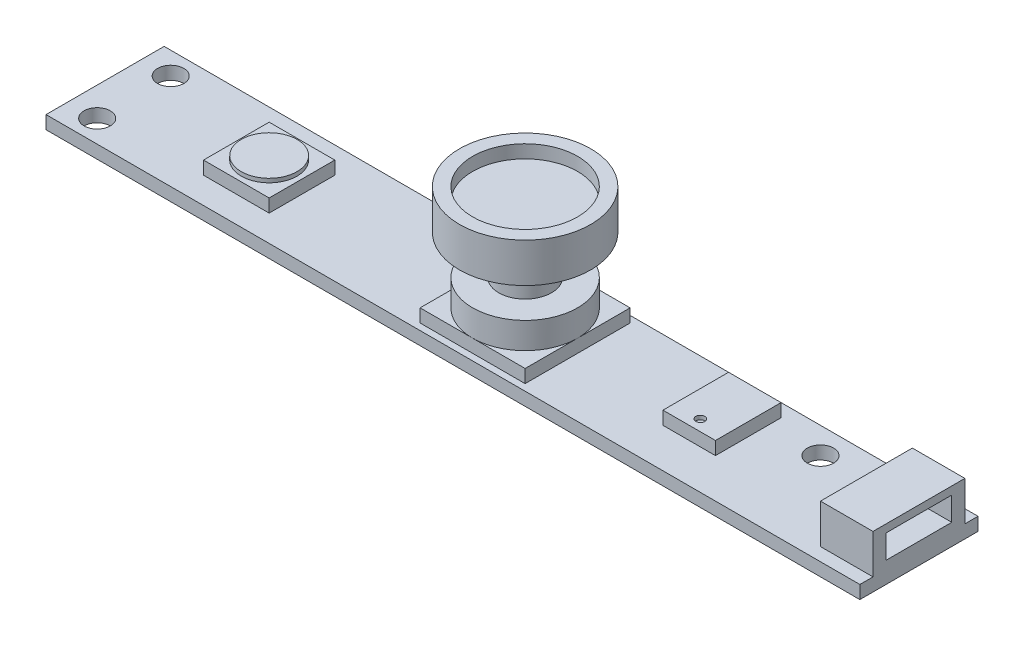
from build123d import *

# Parameters (mm, degrees)
SKETCH1_W            = 62
SKETCH1_H            = 9
BOSS_EXTRUDE1_DEPTH  = 1
BOSS_EXTRUDE2_DEPTH  = 3
SKETCH3_W            = 5
SKETCH3_H            = 1.8
CUT_EXTRUDE1_DEPTH   = 3
SKETCH4_R            = 1
CUT_EXTRUDE2_DEPTH   = 63.721607122
SKETCH5_W            = 4
SKETCH5_H            = 5
BOSS_EXTRUDE4_DEPTH  = 1
BOSS_EXTRUDE5_DEPTH  = 1
SKETCH7_R            = 2.125973312
BOSS_EXTRUDE6_DEPTH  = 0.3
BOSS_EXTRUDE7_DEPTH  = 1
SKETCH9_R            = 4
BOSS_EXTRUDE8_DEPTH  = 2
SKETCH10_R           = 2.014523047
BOSS_EXTRUDE9_DEPTH  = 3
SKETCH11_R           = 5
BOSS_EXTRUDE10_DEPTH = 3
CUT_EXTRUDE3_START   = -1
SKETCH12_R           = 4
CUT_EXTRUDE3_DEPTH   = 1
SKETCH13_R           = 0.341110464
CUT_EXTRUDE4_DEPTH   = 0.3


with BuildPart() as part:
    # Sketch1 → Boss-Extrude1 (new body)
    with BuildSketch(Plane(origin=(0, 0, 0), x_dir=(1, 0, 0), z_dir=(0, 1, 0))):
        with Locations((31, 4.5)):
            Rectangle(SKETCH1_W, SKETCH1_H)
    extrude(amount=BOSS_EXTRUDE1_DEPTH)

    # Sketch2 → Boss-Extrude2 (add)
    with BuildSketch(Plane(origin=(0, 1, 0), x_dir=(1, 0, 0), z_dir=(0, 1, 0))):
        Polygon((62, 4.5), (62, 8), (58, 8), (58, 1), (62, 1), align=None)
    extrude(amount=BOSS_EXTRUDE2_DEPTH)

    # Sketch3 → Cut-Extrude1 (cut)
    with BuildSketch(Plane(origin=(62, 0, 0), x_dir=(0, 0, -1), z_dir=(1, 0, 0))):
        with Locations((4.5, 2.5)):
            Rectangle(SKETCH3_W, SKETCH3_H)
    extrude(amount=-CUT_EXTRUDE1_DEPTH, mode=Mode.SUBTRACT)

    # Sketch4 → Cut-Extrude2 (cut, through all)
    with BuildSketch(Plane(origin=(0, 1, 0), x_dir=(1, 0, 0), z_dir=(0, 1, 0))):
        with Locations((2.2, 7.3)):
            Circle(SKETCH4_R)
        with Locations((2.2, 1.7)):
            Circle(SKETCH4_R)
        with Locations((52, 7)):
            Circle(SKETCH4_R)
    extrude(amount=-CUT_EXTRUDE2_DEPTH, mode=Mode.SUBTRACT)

    # Sketch5 → Boss-Extrude4 (add)
    with BuildSketch(Plane(origin=(0, 1, 0), x_dir=(1, 0, 0), z_dir=(0, 1, 0))):
        with Locations((46, 5.5)):
            Rectangle(SKETCH5_W, SKETCH5_H)
    extrude(amount=BOSS_EXTRUDE4_DEPTH)

    # Sketch6 → Boss-Extrude5 (add)
    with BuildSketch(Plane(origin=(0, 1, 0), x_dir=(1, 0, 0), z_dir=(0, 1, 0))):
        Polygon((10, 7), (10, 4.5), (10, 2), (15, 2), (15, 4.5), (15, 7), align=None)
    extrude(amount=BOSS_EXTRUDE5_DEPTH)

    # Sketch7 → Boss-Extrude6 (add)
    with BuildSketch(Plane(origin=(0, 2, 0), x_dir=(1, 0, 0), z_dir=(0, 1, 0))):
        with Locations((12.5, 4.5)):
            Circle(SKETCH7_R)
    extrude(amount=BOSS_EXTRUDE6_DEPTH)

    # Sketch8 → Boss-Extrude7 (add)
    with BuildSketch(Plane(origin=(0, 1, 0), x_dir=(1, 0, 0), z_dir=(0, 1, 0))):
        Polygon((28, 8.5), (28, 4.5), (28, 0.5), (36, 0.5), (36, 4.5), (36, 8.5), align=None)
    extrude(amount=BOSS_EXTRUDE7_DEPTH)

    # Sketch9 → Boss-Extrude8 (add)
    with BuildSketch(Plane(origin=(0, 2, 0), x_dir=(1, 0, 0), z_dir=(0, 1, 0))):
        with Locations((32, 4.5)):
            Circle(SKETCH9_R)
    extrude(amount=BOSS_EXTRUDE8_DEPTH)

    # Sketch10 → Boss-Extrude9 (add)
    with BuildSketch(Plane(origin=(0, 4, 0), x_dir=(1, 0, 0), z_dir=(0, 1, 0))):
        with Locations((32, 4.5)):
            Circle(SKETCH10_R)
    extrude(amount=BOSS_EXTRUDE9_DEPTH)

    # Sketch11 → Boss-Extrude10 (add)
    with BuildSketch(Plane(origin=(0, 7, 0), x_dir=(1, 0, 0), z_dir=(0, 1, 0))):
        with Locations((32, 4.5)):
            Circle(SKETCH11_R)
    extrude(amount=BOSS_EXTRUDE10_DEPTH)

    # Sketch12 → Cut-Extrude3 (cut)
    with BuildSketch(Plane(origin=(0, 10, 0), x_dir=(1, 0, 0), z_dir=(0, 1, 0)).offset(CUT_EXTRUDE3_START)):
        with Locations((32, 4.5)):
            Circle(SKETCH12_R)
    extrude(amount=CUT_EXTRUDE3_DEPTH, mode=Mode.SUBTRACT)

    # Sketch13 → Cut-Extrude4 (cut)
    with BuildSketch(Plane(origin=(0, 2, 0), x_dir=(1, 0, 0), z_dir=(0, 1, 0))):
        with Locations((46, 3.845478616)):
            Circle(SKETCH13_R)
    extrude(amount=-CUT_EXTRUDE4_DEPTH, mode=Mode.SUBTRACT)


solid = part.part
